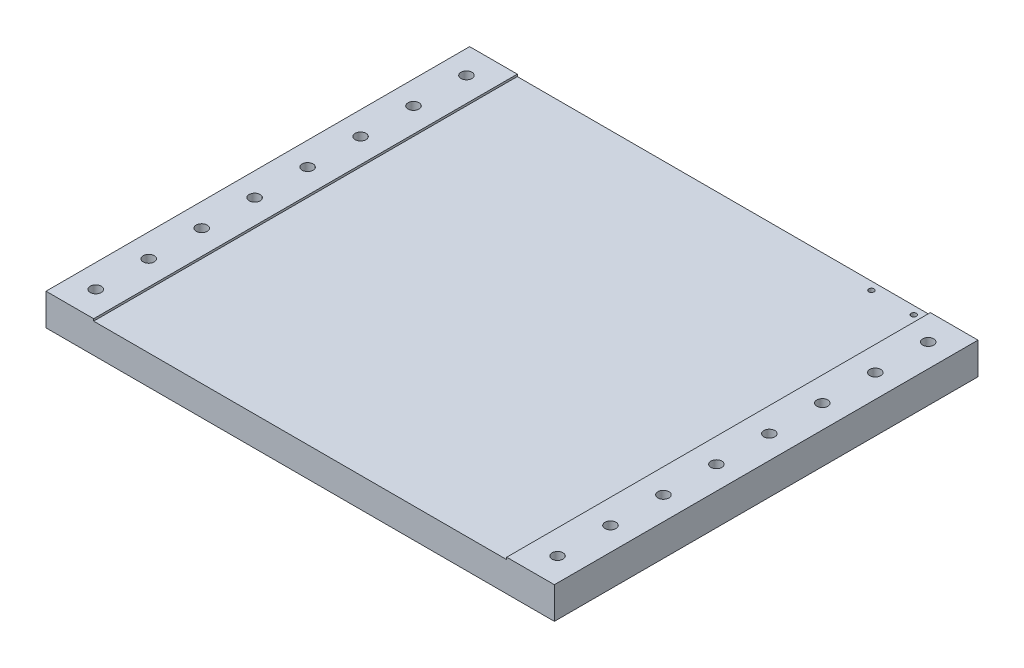
from build123d import *

# Parameters (mm, degrees)
SKETCH1_W                 = 240
SKETCH1_H                 = 200
BOSS_EXTRUDE1_DEPTH       = 7.5
CUT_EXTRUDE2_DEPTH        = 1
SKETCH4_R                 = 2.6
CUT_EXTRUDE3_DEPTH        = 157.923548265
LPATTERN1_COUNT           = 8
LPATTERN1_PITCH           = 25
M3X0_5_TAPPED_HOLE1_D     = 2.5
M3X0_5_TAPPED_HOLE1_DEPTH = 8.5
M3X0_5_TAPPED_HOLE1_TIP   = 0.751075774


with BuildPart() as part:
    # Sketch1 → Boss-Extrude1 (new, symmetric)
    with BuildSketch(Plane(origin=(0, 0, 0), x_dir=(1, 0, 0), z_dir=(0, 1, 0))):
        Rectangle(SKETCH1_W, SKETCH1_H)
    extrude(amount=BOSS_EXTRUDE1_DEPTH, both=True)

    # Sketch3 → Cut-Extrude2 (cut)
    with BuildSketch(Plane(origin=(0, 7.5, 0), x_dir=(1, 0, 0), z_dir=(0, 1, 0))):
        with BuildLine():
            Line((-92.5, -105), (92.5, -105))
            ThreePointArc((92.5, -105), (96.035533906, -103.535533906), (97.5, -100))
            Line((97.5, -100), (97.5, 100))
            ThreePointArc((97.5, 100), (96.035533906, 103.535533906), (92.5, 105))
            Line((92.5, 105), (-92.5, 105))
            ThreePointArc((-92.5, 105), (-96.035533906, 103.535533906), (-97.5, 100))
            Line((-97.5, 100), (-97.5, -100))
            ThreePointArc((-97.5, -100), (-96.035533906, -103.535533906), (-92.5, -105))
        make_face()
    extrude(amount=-CUT_EXTRUDE2_DEPTH, mode=Mode.SUBTRACT)

    # Sketch4 → Cut-Extrude3 (cut, through all)
    with BuildSketch(Plane(origin=(0, 7.5, 0), x_dir=(1, 0, 0), z_dir=(0, 1, 0))):
        with Locations((-109, 87.5)):
            Circle(SKETCH4_R)
        with Locations((109, 87.5)):
            Circle(SKETCH4_R)
    cut_extrude3 = extrude(amount=-CUT_EXTRUDE3_DEPTH, mode=Mode.SUBTRACT)

    # LPattern1: Cut-Extrude3 ×8
    with Locations(*[(0, 0, i * LPATTERN1_PITCH) for i in range(1, LPATTERN1_COUNT)]):
        add(cut_extrude3, mode=Mode.SUBTRACT)

    # M3x0.5 Tapped Hole1
    with Locations(Plane(origin=(0, 6.5, 0), x_dir=(1, 0, 0), z_dir=(0, 1, 0))):
        with Locations((93.5, 96.2), (73.5, 96.2)):
            Hole(M3X0_5_TAPPED_HOLE1_D / 2, depth=M3X0_5_TAPPED_HOLE1_DEPTH)
            with Locations((0, 0, -(M3X0_5_TAPPED_HOLE1_DEPTH + M3X0_5_TAPPED_HOLE1_TIP / 2))):  # 118° drill point
                Cone(0, M3X0_5_TAPPED_HOLE1_D / 2, M3X0_5_TAPPED_HOLE1_TIP, mode=Mode.SUBTRACT)


solid = part.part
